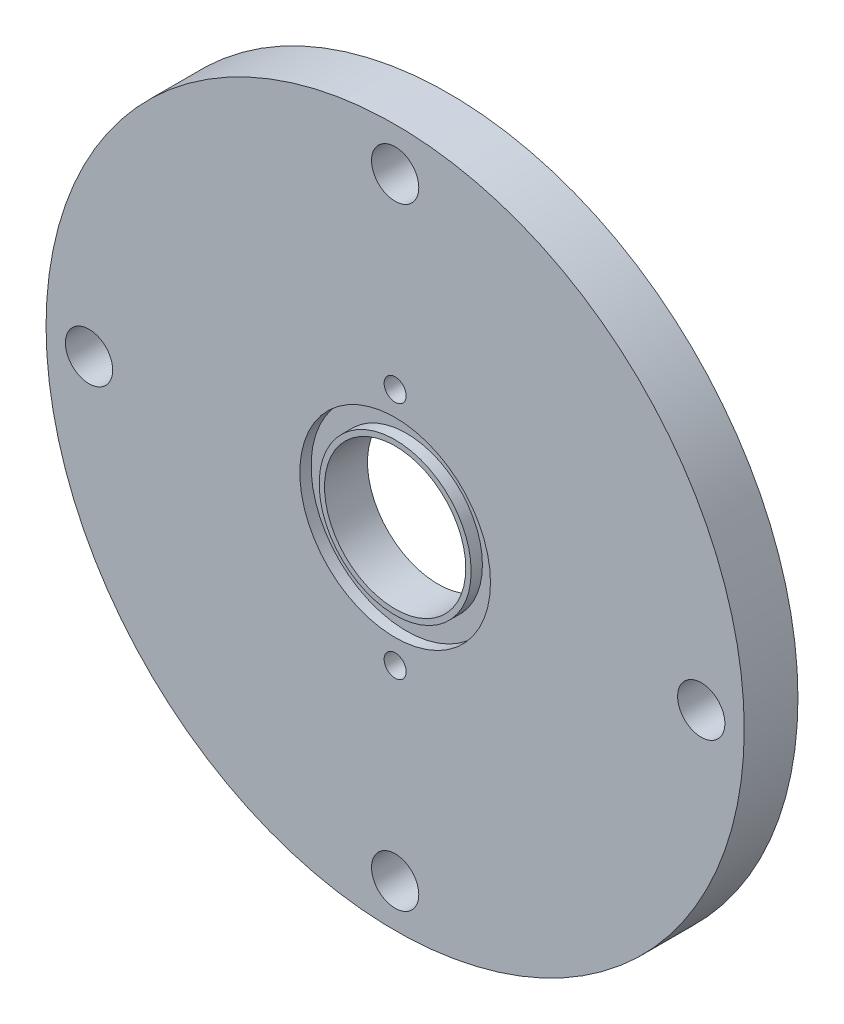
from build123d import *

# Parameters (mm, degrees)
BOSS_EXTRUDE1_START       = -4
BOSS_EXTRUDE1_OUTLINE_R   = 2.2
BOSS_EXTRUDE1_OUTLINE_R_2 = 1.025
BOSS_EXTRUDE1_OUTLINE_R_3 = 6.575
BOSS_EXTRUDE1_DEPTH       = 4
SKETCH3_R                 = 8.875
SKETCH3_R_2               = 7.075
CUT_EXTRUDE1_DEPTH        = 1.05
BOSS_EXTRUDE2_START       = -4
SKETCH4_R                 = 1.025
BOSS_EXTRUDE2_DEPTH       = 0.75
FILLET1_R                 = 1
BOSS_EXTRUDE3_START       = -5
SKETCH5_R                 = 32.5
SKETCH5_R_2               = 1.025
SKETCH5_R_3               = 8.875
BOSS_EXTRUDE3_DEPTH       = 5
SKETCH6_R                 = 2.2
CUT_EXTRUDE2_DEPTH        = 5
SKETCH7_R                 = 20.6
SKETCH7_R_2               = 15.6
CUT_EXTRUDE3_DEPTH        = 2.5
BOSS_EXTRUDE4_START       = 1
SKETCH8_R                 = 1.025
BOSS_EXTRUDE4_DEPTH       = 1


# Read off the part's stored shape, not the designer's step: Boss-Extrude1
with BuildPart() as part:
    # Boss-Extrude1 outline → Boss-Extrude1 (new body)
    with BuildSketch(Plane.XY.offset(BOSS_EXTRUDE1_START)):
        with BuildLine():
            Line((-5.8, 12.8), (-5.8, -12.8))
            ThreePointArc((-5.8, -12.8), (-1.992388155, -21.992388155), (7.2, -25.8))
            Line((7.2, -25.8), (32.8, -25.8))
            ThreePointArc((32.8, -25.8), (41.992388155, -21.992388155), (45.8, -12.8))
            Line((45.8, -12.8), (45.8, 12.8))
            ThreePointArc((45.8, 12.8), (41.992388155, 21.992388155), (32.8, 25.8))
            Line((32.8, 25.8), (7.2, 25.8))
            ThreePointArc((7.2, 25.8), (-1.992388155, 21.992388155), (-5.8, 12.8))
        make_face()
        with Locations((25, -22)):
            Circle(BOSS_EXTRUDE1_OUTLINE_R, mode=Mode.SUBTRACT)
        with Locations((20, -11.1252)):
            Circle(BOSS_EXTRUDE1_OUTLINE_R_2, mode=Mode.SUBTRACT)
        with Locations((-2, 0)):
            Circle(BOSS_EXTRUDE1_OUTLINE_R, mode=Mode.SUBTRACT)
        with Locations((20, 0)):
            Circle(BOSS_EXTRUDE1_OUTLINE_R_3, mode=Mode.SUBTRACT)
        with Locations((20, 11.1252)):
            Circle(BOSS_EXTRUDE1_OUTLINE_R_2, mode=Mode.SUBTRACT)
        with Locations((42, 0)):
            Circle(BOSS_EXTRUDE1_OUTLINE_R, mode=Mode.SUBTRACT)
        with Locations((25, 22)):
            Circle(BOSS_EXTRUDE1_OUTLINE_R, mode=Mode.SUBTRACT)
    extrude(amount=BOSS_EXTRUDE1_DEPTH)

    # Sketch3 → Cut-Extrude1 (cut)
    with BuildSketch(Plane.XY):
        with Locations((20, 0)):
            Circle(SKETCH3_R)
        with Locations((20, 0)):
            Circle(SKETCH3_R_2, mode=Mode.SUBTRACT)
    extrude(amount=-CUT_EXTRUDE1_DEPTH, mode=Mode.SUBTRACT)

    # Sketch4 → Boss-Extrude2 (add)
    with BuildSketch(Plane.XY.offset(BOSS_EXTRUDE2_START)):
        with Locations((20, 11.1252)):
            Circle(SKETCH4_R)
        with Locations((20, -11.1252)):
            Circle(SKETCH4_R)
    extrude(amount=BOSS_EXTRUDE2_DEPTH)

    # Fillet1
    fillet1_edges = [part.edges().sort_by_distance(p)[0] for p in [
        (18.975, 11.1252, -3.25),
        (18.975, -11.1252, -3.25),
    ]]
    fillet(fillet1_edges, radius=FILLET1_R)

    # Sketch5 → Boss-Extrude3 (add)
    with BuildSketch(Plane.XY.offset(BOSS_EXTRUDE3_START)):
        with Locations((20, 0)):
            Circle(SKETCH5_R)
        with Locations((20, -11.1252)):
            Circle(SKETCH5_R_2, mode=Mode.SUBTRACT)
        with Locations((20, 11.1252)):
            Circle(SKETCH5_R_2, mode=Mode.SUBTRACT)
        with Locations((20, 0)):
            Circle(SKETCH5_R_3, mode=Mode.SUBTRACT)
    extrude(amount=BOSS_EXTRUDE3_DEPTH)

    # Sketch6 → Cut-Extrude2 (cut)
    with BuildSketch(Plane.XY):
        with Locations((-8.496265533, -0.461357402)):
            Circle(SKETCH6_R)
        with Locations((20, 28.5)):
            Circle(SKETCH6_R)
        with Locations((48.496265533, -0.461357402)):
            Circle(SKETCH6_R)
        with Locations((20, -28.5)):
            Circle(SKETCH6_R)
    extrude(amount=-CUT_EXTRUDE2_DEPTH, mode=Mode.SUBTRACT)

    # Sketch7 → Cut-Extrude3 (cut)
    with BuildSketch(Plane(origin=(0, 0, -5), x_dir=(-1, 0, 0), z_dir=(0, 0, -1))):
        with Locations((-20, 0)):
            Circle(SKETCH7_R)
        with Locations((-20, 0)):
            Circle(SKETCH7_R_2, mode=Mode.SUBTRACT)
    extrude(amount=-CUT_EXTRUDE3_DEPTH, mode=Mode.SUBTRACT)

    # Sketch8 → Boss-Extrude4 (add)
    with BuildSketch(Plane(origin=(0, 0, -4), x_dir=(-1, 0, 0), z_dir=(0, 0, -1)).offset(BOSS_EXTRUDE4_START)):
        with Locations(Location((-20, -11.1252, 0), (0, 0, 180))):
            Circle(SKETCH8_R)
        with Locations(Location((-20, 11.1252, 0), (0, 0, 180))):
            Circle(SKETCH8_R)
    extrude(amount=-BOSS_EXTRUDE4_DEPTH)


solid = part.part
